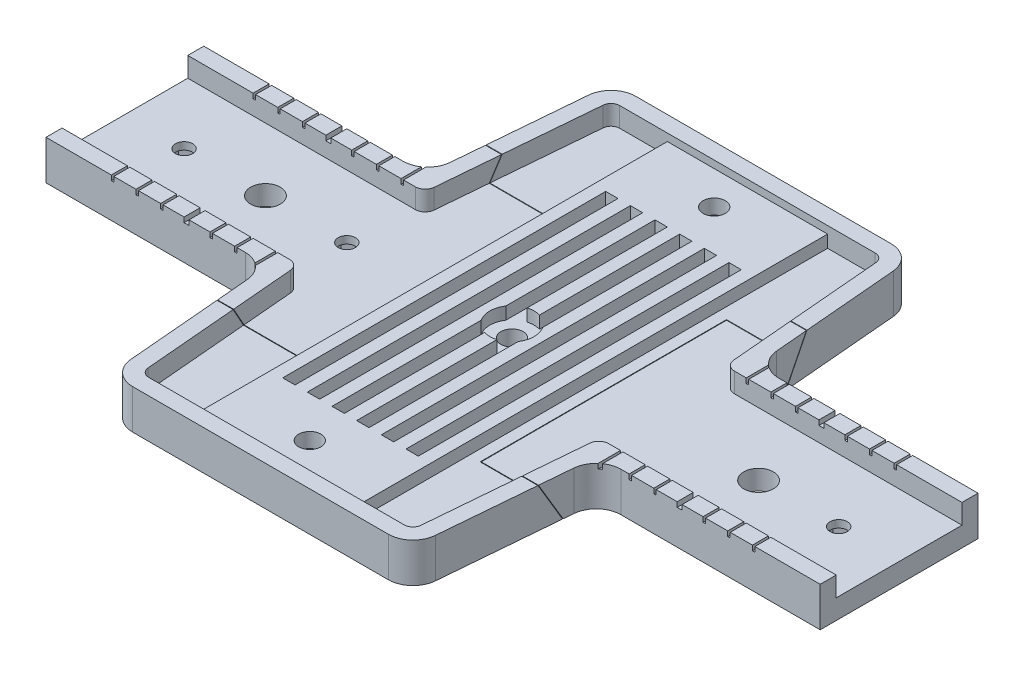
from build123d import *

# Parameters (mm, degrees)
SKETCH_1_W                = 157
SKETCH_1_H                = 32
EXTRUDE_1_DEPTH           = 4
SKETCH_2_R                = 2.25
CUT_EXTRUDE_1_DEPTH       = 161.27788369
EXTRUDE_3_REACH           = 162.278
SKETCH_4_W                = 2.5
SKETCH_4_H                = 2.5
SKETCH_8_R                = 2.25
CUT_EXTRUDE_3_DEPTH       = 161.359751808
SKETCH_10_W               = 45
SKETCH_10_H               = 3.25
EXTRUDE_4_DEPTH           = 4
SKETCH_12_R               = 4.5
CUT_EXTRUDE_4_DEPTH       = 2.5
MIRROR_2_COPY_1_SKETCH_W  = 45
MIRROR_2_COPY_1_SKETCH_H  = 3.25
MIRROR_2_COPY_1_DEPTH     = 4
EXTRUDE_5_DEPTH           = 4
SKETCH_15_R               = 2.25
CUT_EXTRUDE_5_DEPTH       = 171.745424536
SKETCH_16_W               = 4
SKETCH_16_H               = 3.25
MIRROR_5_COPY_1_SKETCH_W  = 4
MIRROR_5_COPY_1_SKETCH_H  = 3.25
EXTRUDE_6_REACH           = 172.886
SKETCH_19_W               = 2.5
SKETCH_19_H               = 2.5
EXTRUDE_7_REACH           = 172.886
SKETCH_20_W               = 2.5
SKETCH_20_H               = 2.5
SKETCH_21_R               = 2.25
CUT_EXTRUDE_6_DEPTH       = 171.745424536
CUT_EXTRUDE_7_DEPTH       = 4
MIRROR_8_COPY_1_DEPTH     = 4
MIRROR_8_COPY_2_DEPTH     = 4
SKETCH_23_R               = 3
CUT_EXTRUDE_8_DEPTH       = 171.885926864
CUT_EXTRUDE_9_DEPTH       = 2
CUT_EXTRUDE_10_DEPTH      = 3.5
EXTRUDE_START             = 2.5
SKETCH_26_R               = 4
SKETCH_26_R_2             = 2.25
EXTRUDE_8_DEPTH           = 2.5
FILLET_3_R                = 1
FILLET_4_R                = 1
SKETCH_27_R               = 1.75
CUT_EXTRUDE_11_DEPTH      = 171.745424536
CUT_EXTRUDE_12_DEPTH      = 2.5
SKETCH2_W                 = 1
SKETCH2_H                 = 3.25
SKETCH2_W_2               = 0.5
CUT_EXTRUDE2_DEPTH        = 1
MIRROR4_COPY_1_SKETCH_W   = 1
MIRROR4_COPY_1_SKETCH_H   = 3.25
MIRROR4_COPY_1_SKETCH_W_2 = 0.5
MIRROR4_COPY_1_DEPTH      = 1
MIRROR4_COPY_2_SKETCH_W   = 1
MIRROR4_COPY_2_SKETCH_H   = 3.25
MIRROR4_COPY_2_SKETCH_W_2 = 0.5
MIRROR4_COPY_2_DEPTH      = 1
SKETCH_32_W               = 32.5
SKETCH_32_H               = 15
SKETCH_32_R               = 2.25
EXTRUDE_9_DEPTH           = 2.5
EXTRUDE_START_2           = 2
EXTRUDE_10_DEPTH          = 2
EXTRUDE_11_DEPTH          = 2
FILLET_5_R                = 5
FILLET_6_R                = 2
FILLET_7_R                = 2
FILLET_8_R                = 2
FILLET_9_R                = 2


with BuildPart() as part:
    # Эскиз1 → Бобышка-Вытянуть1 (new body)
    with BuildSketch(Plane(origin=(0, 0, 0), x_dir=(1, 0, 0), z_dir=(0, 1, 0))):
        with Locations((78.5, 16)):
            Rectangle(SKETCH_1_W, SKETCH_1_H)
    extrude(amount=EXTRUDE_1_DEPTH)

    # Эскиз2 → Вырез-Вытянуть1 (cut, through all)
    with BuildSketch(Plane(origin=(0, 4, 0), x_dir=(1, 0, 0), z_dir=(0, 1, 0))):
        with Locations(Location((78.5, 16, 0), (0, 0, 270))):
            Circle(SKETCH_2_R)
    extrude(amount=-CUT_EXTRUDE_1_DEPTH, mode=Mode.SUBTRACT)

    # Бобышка-Вытянуть3: up to this face of the body (flat: up to its plane)
    extrude_3_end = Plane(part.part.faces().sort_by_distance((78.5, 2, -32))[0])
    # Эскиз4 → Бобышка-Вытянуть3 (add, up to the picked face)
    with BuildSketch(Plane.XY, mode=Mode.PRIVATE) as extrude_3_sk1:
        with Locations((78.5, 5.25)):
            Rectangle(SKETCH_4_W, SKETCH_4_H)
    extrude_3_tool1 = split(extrude(extrude_3_sk1.sketch, amount=-EXTRUDE_3_REACH, mode=Mode.PRIVATE), bisect_by=extrude_3_end, keep=Keep.BOTH, mode=Mode.PRIVATE)
    # Эскиз4 → Бобышка-Вытянуть3 (add, up to the picked face)
    with BuildSketch(Plane.XY, mode=Mode.PRIVATE) as extrude_3_sk2:
        with Locations((83.5, 5.25)):
            Rectangle(SKETCH_4_W, SKETCH_4_H)
    extrude_3_tool2 = split(extrude(extrude_3_sk2.sketch, amount=-EXTRUDE_3_REACH, mode=Mode.PRIVATE), bisect_by=extrude_3_end, keep=Keep.BOTH, mode=Mode.PRIVATE)
    # Эскиз4 → Бобышка-Вытянуть3 (add, up to the picked face)
    with BuildSketch(Plane.XY, mode=Mode.PRIVATE) as extrude_3_sk3:
        with Locations((88.5, 5.25)):
            Rectangle(SKETCH_4_W, SKETCH_4_H)
    extrude_3_tool3 = split(extrude(extrude_3_sk3.sketch, amount=-EXTRUDE_3_REACH, mode=Mode.PRIVATE), bisect_by=extrude_3_end, keep=Keep.BOTH, mode=Mode.PRIVATE)
    # Эскиз4 → Бобышка-Вытянуть3 (add, up to the picked face)
    with BuildSketch(Plane.XY, mode=Mode.PRIVATE) as extrude_3_sk4:
        with Locations((93.5, 5.25)):
            Rectangle(SKETCH_4_W, SKETCH_4_H)
    extrude_3_tool4 = split(extrude(extrude_3_sk4.sketch, amount=-EXTRUDE_3_REACH, mode=Mode.PRIVATE), bisect_by=extrude_3_end, keep=Keep.BOTH, mode=Mode.PRIVATE)
    # Эскиз4 → Бобышка-Вытянуть3 (add, up to the picked face)
    with BuildSketch(Plane.XY, mode=Mode.PRIVATE) as extrude_3_sk5:
        with Locations((73.5, 5.25)):
            Rectangle(SKETCH_4_W, SKETCH_4_H)
    extrude_3_tool5 = split(extrude(extrude_3_sk5.sketch, amount=-EXTRUDE_3_REACH, mode=Mode.PRIVATE), bisect_by=extrude_3_end, keep=Keep.BOTH, mode=Mode.PRIVATE)
    # Эскиз4 → Бобышка-Вытянуть3 (add, up to the picked face)
    with BuildSketch(Plane.XY, mode=Mode.PRIVATE) as extrude_3_sk6:
        with Locations((68.5, 5.25)):
            Rectangle(SKETCH_4_W, SKETCH_4_H)
    extrude_3_tool6 = split(extrude(extrude_3_sk6.sketch, amount=-EXTRUDE_3_REACH, mode=Mode.PRIVATE), bisect_by=extrude_3_end, keep=Keep.BOTH, mode=Mode.PRIVATE)
    # Эскиз4 → Бобышка-Вытянуть3 (add, up to the picked face)
    with BuildSketch(Plane.XY, mode=Mode.PRIVATE) as extrude_3_sk7:
        with Locations((63.5, 5.25)):
            Rectangle(SKETCH_4_W, SKETCH_4_H)
    extrude_3_tool7 = split(extrude(extrude_3_sk7.sketch, amount=-EXTRUDE_3_REACH, mode=Mode.PRIVATE), bisect_by=extrude_3_end, keep=Keep.BOTH, mode=Mode.PRIVATE)
    add(extrude_3_tool1.solids().sort_by(Axis((78.5, 5.25, 0), (0, 0, -1)))[0])
    add(extrude_3_tool2.solids().sort_by(Axis((83.5, 5.25, 0), (0, 0, -1)))[0])
    add(extrude_3_tool3.solids().sort_by(Axis((88.5, 5.25, 0), (0, 0, -1)))[0])
    add(extrude_3_tool4.solids().sort_by(Axis((93.5, 5.25, 0), (0, 0, -1)))[0])
    add(extrude_3_tool5.solids().sort_by(Axis((73.5, 5.25, 0), (0, 0, -1)))[0])
    add(extrude_3_tool6.solids().sort_by(Axis((68.5, 5.25, 0), (0, 0, -1)))[0])
    add(extrude_3_tool7.solids().sort_by(Axis((63.5, 5.25, 0), (0, 0, -1)))[0])

    # Эскиз8 → Вырез-Вытянуть3 (cut, through all)
    with BuildSketch(Plane.XZ):
        with Locations(Location((78.5, -16, 0), (0, 0, 90))):
            Circle(SKETCH_8_R)
    extrude(amount=-CUT_EXTRUDE_3_DEPTH, mode=Mode.SUBTRACT)

    # Эскиз10 → Бобышка-Вытянуть4 (add)
    with BuildSketch(Plane(origin=(0, 4, 0), x_dir=(1, 0, 0), z_dir=(0, 1, 0))):
        with Locations((134.5, 1.625)):
            Rectangle(SKETCH_10_W, SKETCH_10_H)
    extrude_4 = extrude(amount=EXTRUDE_4_DEPTH)

    # Зеркальное отражение1: Бобышка-Вытянуть4 across plane
    add(extrude_4.mirror(Plane(origin=(0, 0, -16), x_dir=(1, 0, 0), z_dir=(0, 0, -1))))

    # Эскиз12 → Вырез-Вытянуть4 (cut)
    with BuildSketch(Plane(origin=(0, 6.5, 0), x_dir=(1, 0, 0), z_dir=(0, 1, 0))):
        with Locations((78.5, 16)):
            Circle(SKETCH_12_R)
    extrude(amount=-CUT_EXTRUDE_4_DEPTH, mode=Mode.SUBTRACT)

    # Зеркальное отражение2: Бобышка-Вытянуть4 across plane
    add(extrude_4.mirror(Plane(origin=(78.5, 0, 0), x_dir=(0, 0, 1), z_dir=(1, 0, 0))))

    # Зеркальное отражение2 copy 1 sketch → Зеркальное отражение2 copy 1 (add)
    with BuildSketch(Plane(origin=(157, 4, -32), x_dir=(-1, 0, 0), z_dir=(0, 1, 0))):
        with Locations((134.5, 1.625)):
            Rectangle(MIRROR_2_COPY_1_SKETCH_W, MIRROR_2_COPY_1_SKETCH_H)
    extrude(amount=MIRROR_2_COPY_1_DEPTH)

    # Эскиз14 → Бобышка-Вытянуть5 (add)
    with BuildSketch(Plane(origin=(0, 4, 0), x_dir=(1, 0, 0), z_dir=(0, 1, 0))):
        with BuildLine():
            Line((112, 0), (109.391970939, -30.427005707))
            ThreePointArc((109.391970939, -30.427005707), (107.791433597, -33.683410684), (104.410237694, -35))
            Line((104.410237694, -35), (52.589762306, -35))
            ThreePointArc((52.589762306, -35), (49.208566403, -33.683410684), (47.608029061, -30.427005707))
            Line((47.608029061, -30.427005707), (45, 0))
            Line((45, 0), (112, 0))
        make_face()
    extrude_5 = extrude(amount=-EXTRUDE_5_DEPTH)

    # Зеркальное отражение3: Бобышка-Вытянуть5 across plane
    add(extrude_5.mirror(Plane(origin=(0, 0, -16), x_dir=(1, 0, 0), z_dir=(0, 0, -1))))

    # Эскиз15 → Вырез-Вытянуть5 (cut, through all)
    with BuildSketch(Plane(origin=(0, 4, 0), x_dir=(1, 0, 0), z_dir=(0, 1, 0))):
        with Locations(Location((78.5, -25, 0), (0, 0, 270))):
            Circle(SKETCH_15_R)
        with Locations(Location((78.5, 57, 0), (0, 0, 90))):
            Circle(SKETCH_15_R)
    extrude(amount=-CUT_EXTRUDE_5_DEPTH, mode=Mode.SUBTRACT)

    # Sweep 2: sweep along a path in Эскиз17
    with BuildLine(Plane(origin=(0, 4, 0), x_dir=(1, 0, 0), z_dir=(0, 1, 0))) as sweep_2_path:
        Line((78.5, -35), (52.589762306, -35))
        ThreePointArc((52.589762306, -35), (49.208566403, -33.683410684), (47.608029061, -30.427005707))
        Line((47.608029061, -30.427005707), (44.721428571, 3.25))
    # Эскиз16 → Sweep 2 (sweep)
    with BuildSketch(Plane.YZ.offset(78.5)):
        with Locations((6, 33.375)):
            Rectangle(SKETCH_16_W, SKETCH_16_H)
    sweep_2 = sweep(path=sweep_2_path.line)

    # Зеркальное отражение4: Sweep 2 across plane
    add(sweep_2.mirror(Plane(origin=(78.5, 0, 0), x_dir=(0, 0, 1), z_dir=(1, 0, 0))))

    # Зеркальное отражение5: Sweep 2 across plane
    add(sweep_2.mirror(Plane(origin=(0, 0, -16), x_dir=(1, 0, 0), z_dir=(0, 0, -1))))

    # Зеркальное отражение5 copy 1: sweep along a path in Зеркальное отражение5 copy 1 path
    with BuildLine(Plane(origin=(157, 4, -32), x_dir=(-1, 0, 0), z_dir=(0, 1, 0))) as mirror_5_copy_1_path:
        Line((78.5, -35), (52.589762306, -35))
        ThreePointArc((52.589762306, -35), (49.208566403, -33.683410684), (47.608029061, -30.427005707))
        Line((47.608029061, -30.427005707), (44.721428571, 3.25))
    # Зеркальное отражение5 copy 1 sketch → Зеркальное отражение5 copy 1 (sweep)
    with BuildSketch(Plane(origin=(78.5, 0, -32), x_dir=(0, 1, 0), z_dir=(-1, 0, 0))):
        with Locations((6, 33.375)):
            Rectangle(MIRROR_5_COPY_1_SKETCH_W, MIRROR_5_COPY_1_SKETCH_H)
    sweep(path=mirror_5_copy_1_path.line)

    # Эскиз19 → Бобышка-Вытянуть6 (add, up to next)
    with BuildSketch(Plane.XY, mode=Mode.PRIVATE) as extrude_6_sk1:
        with Locations((83.5, 5.25)):
            Rectangle(SKETCH_19_W, SKETCH_19_H)
    extrude_6_tool1 = extrude(extrude_6_sk1.sketch, amount=EXTRUDE_6_REACH, mode=Mode.PRIVATE) - part.part
    # Эскиз19 → Бобышка-Вытянуть6 (add, up to next)
    with BuildSketch(Plane.XY, mode=Mode.PRIVATE) as extrude_6_sk2:
        with Locations((73.5, 5.25)):
            Rectangle(SKETCH_19_W, SKETCH_19_H)
    extrude_6_tool2 = extrude(extrude_6_sk2.sketch, amount=EXTRUDE_6_REACH, mode=Mode.PRIVATE) - part.part
    # Эскиз19 → Бобышка-Вытянуть6 (add, up to next)
    with BuildSketch(Plane.XY, mode=Mode.PRIVATE) as extrude_6_sk3:
        with Locations((93.5, 5.25)):
            Rectangle(SKETCH_19_W, SKETCH_19_H)
    extrude_6_tool3 = extrude(extrude_6_sk3.sketch, amount=EXTRUDE_6_REACH, mode=Mode.PRIVATE) - part.part
    # Эскиз19 → Бобышка-Вытянуть6 (add, up to next)
    with BuildSketch(Plane.XY, mode=Mode.PRIVATE) as extrude_6_sk4:
        with Locations((88.5, 5.25)):
            Rectangle(SKETCH_19_W, SKETCH_19_H)
    extrude_6_tool4 = extrude(extrude_6_sk4.sketch, amount=EXTRUDE_6_REACH, mode=Mode.PRIVATE) - part.part
    # Эскиз19 → Бобышка-Вытянуть6 (add, up to next)
    with BuildSketch(Plane.XY, mode=Mode.PRIVATE) as extrude_6_sk5:
        with Locations((78.5, 5.25)):
            Rectangle(SKETCH_19_W, SKETCH_19_H)
    extrude_6_tool5 = extrude(extrude_6_sk5.sketch, amount=EXTRUDE_6_REACH, mode=Mode.PRIVATE) - part.part
    # Эскиз19 → Бобышка-Вытянуть6 (add, up to next)
    with BuildSketch(Plane.XY, mode=Mode.PRIVATE) as extrude_6_sk6:
        with Locations((63.5, 5.25)):
            Rectangle(SKETCH_19_W, SKETCH_19_H)
    extrude_6_tool6 = extrude(extrude_6_sk6.sketch, amount=EXTRUDE_6_REACH, mode=Mode.PRIVATE) - part.part
    # Эскиз19 → Бобышка-Вытянуть6 (add, up to next)
    with BuildSketch(Plane.XY, mode=Mode.PRIVATE) as extrude_6_sk7:
        with Locations((68.5, 5.25)):
            Rectangle(SKETCH_19_W, SKETCH_19_H)
    extrude_6_tool7 = extrude(extrude_6_sk7.sketch, amount=EXTRUDE_6_REACH, mode=Mode.PRIVATE) - part.part
    add(extrude_6_tool1.solids().sort_by_distance((83.5, 5.25, 0))[0])
    add(extrude_6_tool2.solids().sort_by_distance((73.5, 5.25, 0))[0])
    add(extrude_6_tool3.solids().sort_by_distance((93.5, 5.25, 0))[0])
    add(extrude_6_tool4.solids().sort_by_distance((88.5, 5.25, 0))[0])
    add(extrude_6_tool5.solids().sort_by_distance((78.5, 5.25, 0))[0])
    add(extrude_6_tool6.solids().sort_by_distance((63.5, 5.25, 0))[0])
    add(extrude_6_tool7.solids().sort_by_distance((68.5, 5.25, 0))[0])

    # Эскиз20 → Бобышка-Вытянуть7 (add, up to next)
    with BuildSketch(Plane(origin=(0, 0, -32), x_dir=(-1, 0, 0), z_dir=(0, 0, -1)), mode=Mode.PRIVATE) as extrude_7_sk1:
        with Locations((-83.5, 5.25)):
            Rectangle(SKETCH_20_W, SKETCH_20_H)
    extrude_7_tool1 = extrude(extrude_7_sk1.sketch, amount=EXTRUDE_7_REACH, mode=Mode.PRIVATE) - part.part
    # Эскиз20 → Бобышка-Вытянуть7 (add, up to next)
    with BuildSketch(Plane(origin=(0, 0, -32), x_dir=(-1, 0, 0), z_dir=(0, 0, -1)), mode=Mode.PRIVATE) as extrude_7_sk2:
        with Locations((-73.5, 5.25)):
            Rectangle(SKETCH_20_W, SKETCH_20_H)
    extrude_7_tool2 = extrude(extrude_7_sk2.sketch, amount=EXTRUDE_7_REACH, mode=Mode.PRIVATE) - part.part
    # Эскиз20 → Бобышка-Вытянуть7 (add, up to next)
    with BuildSketch(Plane(origin=(0, 0, -32), x_dir=(-1, 0, 0), z_dir=(0, 0, -1)), mode=Mode.PRIVATE) as extrude_7_sk3:
        with Locations((-93.5, 5.25)):
            Rectangle(SKETCH_20_W, SKETCH_20_H)
    extrude_7_tool3 = extrude(extrude_7_sk3.sketch, amount=EXTRUDE_7_REACH, mode=Mode.PRIVATE) - part.part
    # Эскиз20 → Бобышка-Вытянуть7 (add, up to next)
    with BuildSketch(Plane(origin=(0, 0, -32), x_dir=(-1, 0, 0), z_dir=(0, 0, -1)), mode=Mode.PRIVATE) as extrude_7_sk4:
        with Locations((-88.5, 5.25)):
            Rectangle(SKETCH_20_W, SKETCH_20_H)
    extrude_7_tool4 = extrude(extrude_7_sk4.sketch, amount=EXTRUDE_7_REACH, mode=Mode.PRIVATE) - part.part
    # Эскиз20 → Бобышка-Вытянуть7 (add, up to next)
    with BuildSketch(Plane(origin=(0, 0, -32), x_dir=(-1, 0, 0), z_dir=(0, 0, -1)), mode=Mode.PRIVATE) as extrude_7_sk5:
        with Locations((-78.5, 5.25)):
            Rectangle(SKETCH_20_W, SKETCH_20_H)
    extrude_7_tool5 = extrude(extrude_7_sk5.sketch, amount=EXTRUDE_7_REACH, mode=Mode.PRIVATE) - part.part
    # Эскиз20 → Бобышка-Вытянуть7 (add, up to next)
    with BuildSketch(Plane(origin=(0, 0, -32), x_dir=(-1, 0, 0), z_dir=(0, 0, -1)), mode=Mode.PRIVATE) as extrude_7_sk6:
        with Locations((-63.5, 5.25)):
            Rectangle(SKETCH_20_W, SKETCH_20_H)
    extrude_7_tool6 = extrude(extrude_7_sk6.sketch, amount=EXTRUDE_7_REACH, mode=Mode.PRIVATE) - part.part
    # Эскиз20 → Бобышка-Вытянуть7 (add, up to next)
    with BuildSketch(Plane(origin=(0, 0, -32), x_dir=(-1, 0, 0), z_dir=(0, 0, -1)), mode=Mode.PRIVATE) as extrude_7_sk7:
        with Locations((-68.5, 5.25)):
            Rectangle(SKETCH_20_W, SKETCH_20_H)
    extrude_7_tool7 = extrude(extrude_7_sk7.sketch, amount=EXTRUDE_7_REACH, mode=Mode.PRIVATE) - part.part
    add(extrude_7_tool1.solids().sort_by_distance((83.5, 5.25, -32))[0])
    add(extrude_7_tool2.solids().sort_by_distance((73.5, 5.25, -32))[0])
    add(extrude_7_tool3.solids().sort_by_distance((93.5, 5.25, -32))[0])
    add(extrude_7_tool4.solids().sort_by_distance((88.5, 5.25, -32))[0])
    add(extrude_7_tool5.solids().sort_by_distance((78.5, 5.25, -32))[0])
    add(extrude_7_tool6.solids().sort_by_distance((63.5, 5.25, -32))[0])
    add(extrude_7_tool7.solids().sort_by_distance((68.5, 5.25, -32))[0])

    # Эскиз21 → Вырез-Вытянуть6 (cut, through all)
    with BuildSketch(Plane.XZ.offset(-4)):
        with Locations(Location((78.5, 25, 0), (0, 0, 90))):
            Circle(SKETCH_21_R)
        with Locations(Location((78.5, -57, 0), (0, 0, 123.748988596))):
            Circle(SKETCH_21_R)
    extrude(amount=-CUT_EXTRUDE_6_DEPTH, mode=Mode.SUBTRACT)

    # Эскиз22 → Вырез-Вытянуть7 (cut)
    with BuildSketch(Plane(origin=(0, 8, 0), x_dir=(1, 0, 0), z_dir=(0, 1, 0))):
        Polygon((109.016654501, 3.25), (109.040444819, 3.527553709), (112.278571429, 3.25), align=None)
    cut_extrude_7 = extrude(amount=-CUT_EXTRUDE_7_DEPTH, mode=Mode.SUBTRACT)

    # Зеркальное отражение7: Вырез-Вытянуть7 across plane
    add(cut_extrude_7.mirror(Plane(origin=(0, 0, -16), x_dir=(1, 0, 0), z_dir=(0, 0, -1))), mode=Mode.SUBTRACT)

    # Зеркальное отражение8 copy 1 sketch → Зеркальное отражение8 copy 1 (cut)
    with BuildSketch(Plane(origin=(157, 8, -32), x_dir=(-1, 0, 0), z_dir=(0, 1, 0))):
        Polygon((109.016654501, 3.25), (109.040444819, 3.527553709), (112.278571429, 3.25), align=None)
    extrude(amount=-MIRROR_8_COPY_1_DEPTH, mode=Mode.SUBTRACT)

    # Зеркальное отражение8 copy 2 sketch → Зеркальное отражение8 copy 2 (cut)
    with BuildSketch(Plane(origin=(157, 8, 0), x_dir=(-1, 0, 0), z_dir=(0, 1, 0))):
        Polygon((109.016654501, -3.25), (109.040444819, -3.527553709), (112.278571429, -3.25), align=None)
    extrude(amount=-MIRROR_8_COPY_2_DEPTH, mode=Mode.SUBTRACT)

    # Эскиз23 → Вырез-Вытянуть8 (cut, through all)
    with BuildSketch(Plane.XZ):
        with Locations(Location((28.5, -16, 0), (0, 0, 270))):
            Circle(SKETCH_23_R)
        with Locations(Location((128.5, -16, 0), (0, 0, 270))):
            Circle(SKETCH_23_R)
    extrude(amount=-CUT_EXTRUDE_8_DEPTH, mode=Mode.SUBTRACT)

    # Эскиз24 → Вырез-Вытянуть9 (cut)
    with BuildSketch(Plane(origin=(0, 8, 0), x_dir=(1, 0, 0), z_dir=(0, 1, 0))):
        with BuildLine():
            Line((45, 0), (45, 3.25))
            Line((45, 3.25), (47.983345499, 3.25))
            Line((47.983345499, 3.25), (50.84615567, -30.149451997))
            ThreePointArc((50.84615567, -30.149451997), (51.40634374, -31.289193739), (52.589762306, -31.75))
            Line((52.589762306, -31.75), (104.410237694, -31.75))
            ThreePointArc((104.410237694, -31.75), (105.59365626, -31.289193739), (106.15384433, -30.149451997))
            Line((106.15384433, -30.149451997), (109.016654501, 3.25))
            Line((109.016654501, 3.25), (112, 3.25))
            Line((112, 3.25), (112, 0))
            Line((112, 0), (109.391970939, -30.427005707))
            ThreePointArc((109.391970939, -30.427005707), (107.791433597, -33.683410684), (104.410237694, -35))
            Line((104.410237694, -35), (52.589762306, -35))
            ThreePointArc((52.589762306, -35), (49.208566403, -33.683410684), (47.608029061, -30.427005707))
            Line((47.608029061, -30.427005707), (45, 0))
        make_face()
    cut_extrude_9 = extrude(amount=-CUT_EXTRUDE_9_DEPTH, mode=Mode.SUBTRACT)

    # Зеркальное отражение9: Вырез-Вытянуть9 across plane
    add(cut_extrude_9.mirror(Plane(origin=(0, 0, -16), x_dir=(1, 0, 0), z_dir=(0, 0, -1))), mode=Mode.SUBTRACT)

    # Эскиз25 → Вырез-Вытянуть10 (cut)
    with BuildSketch(Plane.XZ):
        Polygon((74.458548116, 25), (76.479274058, 21.5), (80.520725942, 21.5), (82.541451884, 25), (80.520725942, 28.5), (76.479274058, 28.5), align=None)
    cut_extrude_10 = extrude(amount=-CUT_EXTRUDE_10_DEPTH, mode=Mode.SUBTRACT)

    # Эскиз26 → Бобышка-Вытянуть8 (add)
    # profile 1 of 2: a face of its own
    with BuildSketch(Plane(origin=(0, 4, 0), x_dir=(1, 0, 0), z_dir=(0, 1, 0)).offset(EXTRUDE_START)):
        with Locations((78.5, -25)):
            Circle(SKETCH_26_R)
        with Locations(Location((78.5, -25, 0), (0, 0, 180))):
            Circle(SKETCH_26_R_2, mode=Mode.SUBTRACT)
    # profile 2 of 2: a face of its own
    with BuildSketch(Plane(origin=(0, 4, 0), x_dir=(1, 0, 0), z_dir=(0, 1, 0)).offset(EXTRUDE_START)):
        with Locations((78.5, 57)):
            Circle(SKETCH_26_R)
        with Locations(Location((78.5, 57, 0), (0, 0, 180))):
            Circle(SKETCH_26_R_2, mode=Mode.SUBTRACT)
    extrude(amount=-EXTRUDE_8_DEPTH)

    # Скругление3
    fillet_3_edges = [part.edges().sort_by_distance(p)[0] for p in [
        (74.75, 5.25, 23.608058909),
        (74.75, 5.25, 26.391941091),
        (82.25, 5.25, 23.608058909),
        (82.25, 5.25, 26.391941091),
    ]]
    fillet(fillet_3_edges, radius=FILLET_3_R)

    # Скругление4
    fillet_4_edges = [part.edges().sort_by_distance(p)[0] for p in [
        (74.75, 5.25, -55.608058909),
        (74.75, 5.25, -58.391941091),
        (82.25, 5.25, -58.391941091),
        (82.25, 5.25, -55.608058909),
    ]]
    fillet(fillet_4_edges, radius=FILLET_4_R)

    # Зеркальное отражение12: Вырез-Вытянуть10 across plane
    add(cut_extrude_10.mirror(Plane(origin=(0, 0, -16), x_dir=(1, 0, 0), z_dir=(0, 0, -1))), mode=Mode.SUBTRACT)

    # Эскиз27 → Вырез-Вытянуть11 (cut, through all)
    with BuildSketch(Plane(origin=(0, 4, 0), x_dir=(1, 0, 0), z_dir=(0, 1, 0))):
        with Locations(Location((45, 16, 0), (0, 0, 270))):
            Circle(SKETCH_27_R)
        with Locations(Location((12, 16, 0), (0, 0, 270))):
            Circle(SKETCH_27_R)
        with Locations(Location((144.75, 16, 0), (0, 0, 270))):
            Circle(SKETCH_27_R)
    extrude(amount=-CUT_EXTRUDE_11_DEPTH, mode=Mode.SUBTRACT)

    # Эскиз28 → Вырез-Вытянуть12 (cut)
    with BuildSketch(Plane.XZ):
        Polygon((12, -19.175426481), (14.75, -17.58771324), (14.75, -14.41228676), (12, -12.824573519), (9.25, -14.41228676), (9.25, -17.58771324), align=None)
        Polygon((45, -19.175426481), (47.75, -17.58771324), (47.75, -14.41228676), (45, -12.824573519), (42.25, -14.41228676), (42.25, -17.58771324), align=None)
        Polygon((144.75, -19.175426481), (147.5, -17.58771324), (147.5, -14.41228676), (144.75, -12.824573519), (142, -14.41228676), (142, -17.58771324), align=None)
    extrude(amount=-CUT_EXTRUDE_12_DEPTH, mode=Mode.SUBTRACT)

    # Sketch2 → Cut-Extrude2 (cut)
    with BuildSketch(Plane(origin=(0, 8, 0), x_dir=(1, 0, 0), z_dir=(0, 1, 0))):
        with Locations((28.5, 1.625)):
            Rectangle(SKETCH2_W, SKETCH2_H)
        with Locations((33.5, 1.625)):
            Rectangle(SKETCH2_W_2, SKETCH2_H)
        with Locations((38.5, 1.625)):
            Rectangle(SKETCH2_W_2, SKETCH2_H)
        with Locations((43.5, 1.625)):
            Rectangle(SKETCH2_W_2, SKETCH2_H)
        with Locations((13.5, 1.625)):
            Rectangle(SKETCH2_W_2, SKETCH2_H)
        with Locations((18.5, 1.625)):
            Rectangle(SKETCH2_W_2, SKETCH2_H)
        with Locations((23.5, 1.625)):
            Rectangle(SKETCH2_W_2, SKETCH2_H)
    cut_extrude2 = extrude(amount=-CUT_EXTRUDE2_DEPTH, mode=Mode.SUBTRACT)

    # Mirror2: Cut-Extrude2 across plane
    add(cut_extrude2.mirror(Plane(origin=(78.5, 0, 0), x_dir=(0, 0, 1), z_dir=(1, 0, 0))), mode=Mode.SUBTRACT)

    # Mirror3: Cut-Extrude2 across plane
    add(cut_extrude2.mirror(Plane(origin=(0, 0, -16), x_dir=(1, 0, 0), z_dir=(0, 0, -1))), mode=Mode.SUBTRACT)

    # Mirror4 copy 1 sketch → Mirror4 copy 1 (cut)
    with BuildSketch(Plane(origin=(157, 8, -32), x_dir=(-1, 0, 0), z_dir=(0, 1, 0))):
        with Locations((28.5, 1.625)):
            Rectangle(MIRROR4_COPY_1_SKETCH_W, MIRROR4_COPY_1_SKETCH_H)
        with Locations((33.5, 1.625)):
            Rectangle(MIRROR4_COPY_1_SKETCH_W_2, MIRROR4_COPY_1_SKETCH_H)
        with Locations((38.5, 1.625)):
            Rectangle(MIRROR4_COPY_1_SKETCH_W_2, MIRROR4_COPY_1_SKETCH_H)
        with Locations((43.5, 1.625)):
            Rectangle(MIRROR4_COPY_1_SKETCH_W_2, MIRROR4_COPY_1_SKETCH_H)
        with Locations((13.5, 1.625)):
            Rectangle(MIRROR4_COPY_1_SKETCH_W_2, MIRROR4_COPY_1_SKETCH_H)
        with Locations((18.5, 1.625)):
            Rectangle(MIRROR4_COPY_1_SKETCH_W_2, MIRROR4_COPY_1_SKETCH_H)
        with Locations((23.5, 1.625)):
            Rectangle(MIRROR4_COPY_1_SKETCH_W_2, MIRROR4_COPY_1_SKETCH_H)
    extrude(amount=-MIRROR4_COPY_1_DEPTH, mode=Mode.SUBTRACT)

    # Mirror4 copy 2 sketch → Mirror4 copy 2 (cut)
    with BuildSketch(Plane(origin=(0, 8, -32), x_dir=(1, 0, 0), z_dir=(0, 1, 0))):
        with Locations((28.5, -1.625)):
            Rectangle(MIRROR4_COPY_2_SKETCH_W, MIRROR4_COPY_2_SKETCH_H)
        with Locations((33.5, -1.625)):
            Rectangle(MIRROR4_COPY_2_SKETCH_W_2, MIRROR4_COPY_2_SKETCH_H)
        with Locations((38.5, -1.625)):
            Rectangle(MIRROR4_COPY_2_SKETCH_W_2, MIRROR4_COPY_2_SKETCH_H)
        with Locations((43.5, -1.625)):
            Rectangle(MIRROR4_COPY_2_SKETCH_W_2, MIRROR4_COPY_2_SKETCH_H)
        with Locations((13.5, -1.625)):
            Rectangle(MIRROR4_COPY_2_SKETCH_W_2, MIRROR4_COPY_2_SKETCH_H)
        with Locations((18.5, -1.625)):
            Rectangle(MIRROR4_COPY_2_SKETCH_W_2, MIRROR4_COPY_2_SKETCH_H)
        with Locations((23.5, -1.625)):
            Rectangle(MIRROR4_COPY_2_SKETCH_W_2, MIRROR4_COPY_2_SKETCH_H)
    extrude(amount=-MIRROR4_COPY_2_DEPTH, mode=Mode.SUBTRACT)

    # Эскиз32 → Бобышка-Вытянуть9 (add)
    with BuildSketch(Plane(origin=(0, 6.5, 0), x_dir=(1, 0, 0), z_dir=(0, 1, 0))):
        with Locations((78.5, 56.25)):
            Rectangle(SKETCH_32_W, SKETCH_32_H)
        with Locations(Location((78.5, 57, 0), (0, 0, 180))):
            Circle(SKETCH_32_R, mode=Mode.SUBTRACT)
    extrude_9 = extrude(amount=-EXTRUDE_9_DEPTH)

    # Зеркальное отражение13: Бобышка-Вытянуть9 across plane
    add(extrude_9.mirror(Plane(origin=(0, 0, -16), x_dir=(1, 0, 0), z_dir=(0, 0, -1))))

    # Эскиз33 → Бобышка-Вытянуть10 (add)
    with BuildSketch(Plane(origin=(0, 6, 0), x_dir=(1, 0, 0), z_dir=(0, 1, 0)).offset(EXTRUDE_START_2)):
        with BuildLine():
            Line((47.608029061, 62.427005707), (45, 32))
            Line((45, 32), (45, 28.75))
            Line((45, 28.75), (47.983345499, 28.75))
            Line((47.983345499, 28.75), (50.84615567, 62.149451997))
            ThreePointArc((50.84615567, 62.149451997), (51.40634374, 63.289193739), (52.589762306, 63.75))
            Line((52.589762306, 63.75), (62.25, 63.75))
            Line((62.25, 63.75), (94.75, 63.75))
            Line((94.75, 63.75), (104.410237694, 63.75))
            ThreePointArc((104.410237694, 63.75), (105.59365626, 63.289193739), (106.15384433, 62.149451997))
            Line((106.15384433, 62.149451997), (109.016654501, 28.75))
            Line((109.016654501, 28.75), (112, 28.75))
            Line((112, 28.75), (112, 32))
            Line((112, 32), (109.391970939, 62.427005707))
            ThreePointArc((109.391970939, 62.427005707), (107.791433597, 65.683410684), (104.410237694, 67))
            Line((104.410237694, 67), (52.589762306, 67))
            ThreePointArc((52.589762306, 67), (49.208566403, 65.683410684), (47.608029061, 62.427005707))
        make_face()
    extrude(amount=-EXTRUDE_10_DEPTH)

    # Эскиз34 → Бобышка-Вытянуть11 (add)
    with BuildSketch(Plane(origin=(0, 6, 0), x_dir=(1, 0, 0), z_dir=(0, 1, 0)).offset(EXTRUDE_START_2)):
        with BuildLine():
            Line((45, 3.25), (45, 0))
            Line((45, 0), (47.608029061, -30.427005707))
            ThreePointArc((47.608029061, -30.427005707), (49.208566403, -33.683410684), (52.589762306, -35))
            Line((52.589762306, -35), (104.410237694, -35))
            ThreePointArc((104.410237694, -35), (107.791433597, -33.683410684), (109.391970939, -30.427005707))
            Line((109.391970939, -30.427005707), (112, 0))
            Line((112, 0), (112, 3.25))
            Line((112, 3.25), (109.016654501, 3.25))
            Line((109.016654501, 3.25), (106.15384433, -30.149451997))
            ThreePointArc((106.15384433, -30.149451997), (105.59365626, -31.289193739), (104.410237694, -31.75))
            Line((104.410237694, -31.75), (94.75, -31.75))
            Line((94.75, -31.75), (62.25, -31.75))
            Line((62.25, -31.75), (52.589762306, -31.75))
            ThreePointArc((52.589762306, -31.75), (51.40634374, -31.289193739), (50.84615567, -30.149451997))
            Line((50.84615567, -30.149451997), (47.983345499, 3.25))
            Line((47.983345499, 3.25), (45, 3.25))
        make_face()
    extrude(amount=-EXTRUDE_11_DEPTH)

    # Скругление5
    fillet_5_edges = [part.edges().sort_by_distance(p)[0] for p in [
        (112, 4, 0),
        (112, 4, -32),
        (45, 4, -32),
        (45, 4, 0),
    ]]
    fillet(fillet_5_edges, radius=FILLET_5_R)

    # Вырез-По траектории1: sweep along a path in Эскиз36
    with BuildLine(Plane.XZ) as sweep_1_path:
        Line((45.562773222, 6.565687591), (57.562773222, 6.565687591))
        Line((57.562773222, 6.565687591), (57.562773222, -38.565687591))
        Line((57.562773222, -38.565687591), (45.562773222, -38.565687591))
    # Эскиз35 → Вырез-По траектории1 (sweep, cut)
    with BuildSketch(Plane(origin=(44.671799028, 0, -3.829011345), x_dir=(0.08540114134643484, 0, 0.9963466490417511), z_dir=(-0.9963466490417512, 0, 0.08540114134643484))):
        Polygon((15.05161582, 8), (15.167085874, 8), (10.54828372, 0), (10.432813666, 0), align=None)
    sweep(path=sweep_1_path.line, transition=Transition.RIGHT, mode=Mode.SUBTRACT)


with BuildPart() as sweep_1_piece_1:
    # of the separate pieces the step leaves, piece 1, a body of its own (sweep_1_pieces)
    add(part.part.solids().sort_by_distance((45.572634497, 0, 6.680735793))[0])

    # Sweep 2 2: sweep along a path in Эскиз38
    with BuildLine(Plane.XZ) as sweep_2_2_path:
        Line((111.437226778, -38.565687591), (99.437226778, -38.565687591))
        Line((99.437226778, -38.565687591), (99.437226778, 6.565687591))
        Line((99.437226778, 6.565687591), (111.437226778, 6.565687591))
    # Эскиз37 → Sweep 2 2 (sweep, cut)
    with BuildSketch(Plane(origin=(113.905996759, 0, -9.763371151), x_dir=(-0.08540114134643552, 0, -0.9963466490417511), z_dir=(0.9963466490417511, 0, -0.08540114134643552))):
        Polygon((29.023397298, 0), (28.907927244, 0), (33.526729398, 8), (33.642199452, 8), align=None)
    sweep(path=sweep_2_2_path.line, transition=Transition.RIGHT, mode=Mode.SUBTRACT)


with BuildPart() as sweep_1_piece_2:
    # of the separate pieces the step leaves, piece 2, a body of its own (sweep_1_pieces)
    add(part.part.solids().sort_by_distance((40.410237694, 0, 0))[0])

    # Скругление8
    fillet_8_edges = [sweep_1_piece_2.edges().sort_by_distance(p)[0] for p in [
        (47.983345499, 6, -28.75),
    ]]
    fillet(fillet_8_edges, radius=FILLET_8_R)

    # Скругление9
    fillet_9_edges = [sweep_1_piece_2.edges().sort_by_distance(p)[0] for p in [
        (47.983345499, 6, -3.25),
    ]]
    fillet(fillet_9_edges, radius=FILLET_9_R)


with BuildPart() as sweep_2_2_piece_1:
    # of the separate pieces the step leaves, piece 1, a body of its own (sweep_2_2_pieces)
    add(sweep_1_piece_1.part.solids().sort_by_distance((45.572634497, 0, 6.680735793))[0])


with BuildPart() as sweep_2_2_piece_2:
    # of the separate pieces the step leaves, piece 2, a body of its own (sweep_2_2_pieces)
    add(sweep_1_piece_1.part.solids().sort_by_distance((99.437226778, 0, 6.565687591))[0])

    # Скругление6
    fillet_6_edges = [sweep_2_2_piece_2.edges().sort_by_distance(p)[0] for p in [
        (109.016654501, 6, -28.75),
    ]]
    fillet(fillet_6_edges, radius=FILLET_6_R)

    # Скругление7
    fillet_7_edges = [sweep_2_2_piece_2.edges().sort_by_distance(p)[0] for p in [
        (109.016654501, 6, -3.25),
    ]]
    fillet(fillet_7_edges, radius=FILLET_7_R)


solid = Compound([sweep_1_piece_2.part, sweep_2_2_piece_1.part, sweep_2_2_piece_2.part])
